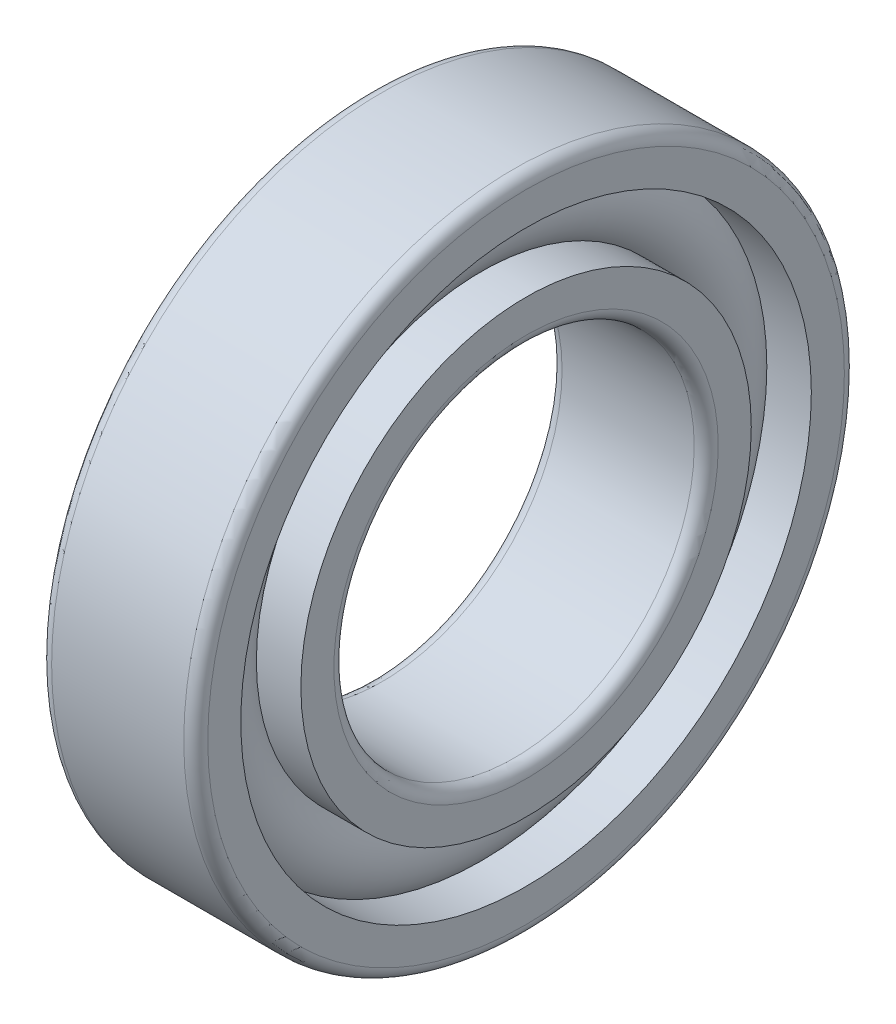
from build123d import *

# Parameters (mm, degrees)
CAGSPISKE_W     = 0.75
CAGSPISKE_H     = 1.25
CAGESPINE_ANGLE = 0.001
BALSIMSKE_R     = 3.75


with BuildPart() as part:
    # CagSpiSke → CageSpine (revolve)
    with BuildSketch(Plane.XY):
        with Locations((0, 21.25)):
            Rectangle(CAGSPISKE_W, CAGSPISKE_H)
    revolve(axis=Axis((-20.6375, 0, 0), (-1, 0, 0)), revolution_arc=CAGESPINE_ANGLE)

    # BalSimSke → BallsSimplified (revolve)
    with BuildSketch(Plane.XY):
        with Locations((0, 21.25)):
            Circle(BALSIMSKE_R)
    revolve(axis=Axis((-10, 0, 0), (1, 0, 0)))

    # InnRacSke → InnerRace (revolve)
    with BuildSketch(Plane.XY):
        with BuildLine():
            Line((-2.761453422, 18.75), (-6.5, 18.75))
            Line((-6.5, 18.75), (-6.5, 16))
            ThreePointArc((-6.5, 16), (-6.207106781, 15.292893219), (-5.5, 15))
            Line((-5.5, 15), (5.5, 15))
            ThreePointArc((5.5, 15), (6.207106781, 15.292893219), (6.5, 16))
            Line((6.5, 16), (6.5, 18.75))
            Line((6.5, 18.75), (2.761453422, 18.75))
            ThreePointArc((2.761453422, 18.75), (0, 17.525), (-2.761453422, 18.75))
        make_face()
    revolve(axis=Axis((-20.6375, 0, 0), (1, 0, 0)))

    # OutRacSke → OuterRace (revolve)
    with BuildSketch(Plane.XY):
        with BuildLine():
            Line((-2.761453422, 23.75), (-6.5, 23.75))
            Line((-6.5, 23.75), (-6.5, 26.5))
            ThreePointArc((-6.5, 26.5), (-6.207106781, 27.207106781), (-5.5, 27.5))
            Line((-5.5, 27.5), (5.5, 27.5))
            ThreePointArc((5.5, 27.5), (6.207106781, 27.207106781), (6.5, 26.5))
            Line((6.5, 26.5), (6.5, 23.75))
            Line((6.5, 23.75), (2.761453422, 23.75))
            ThreePointArc((2.761453422, 23.75), (0, 24.975), (-2.761453422, 23.75))
        make_face()
    revolve(axis=Axis((-20.6375, 0, 0), (1, 0, 0)))


solid = part.part
